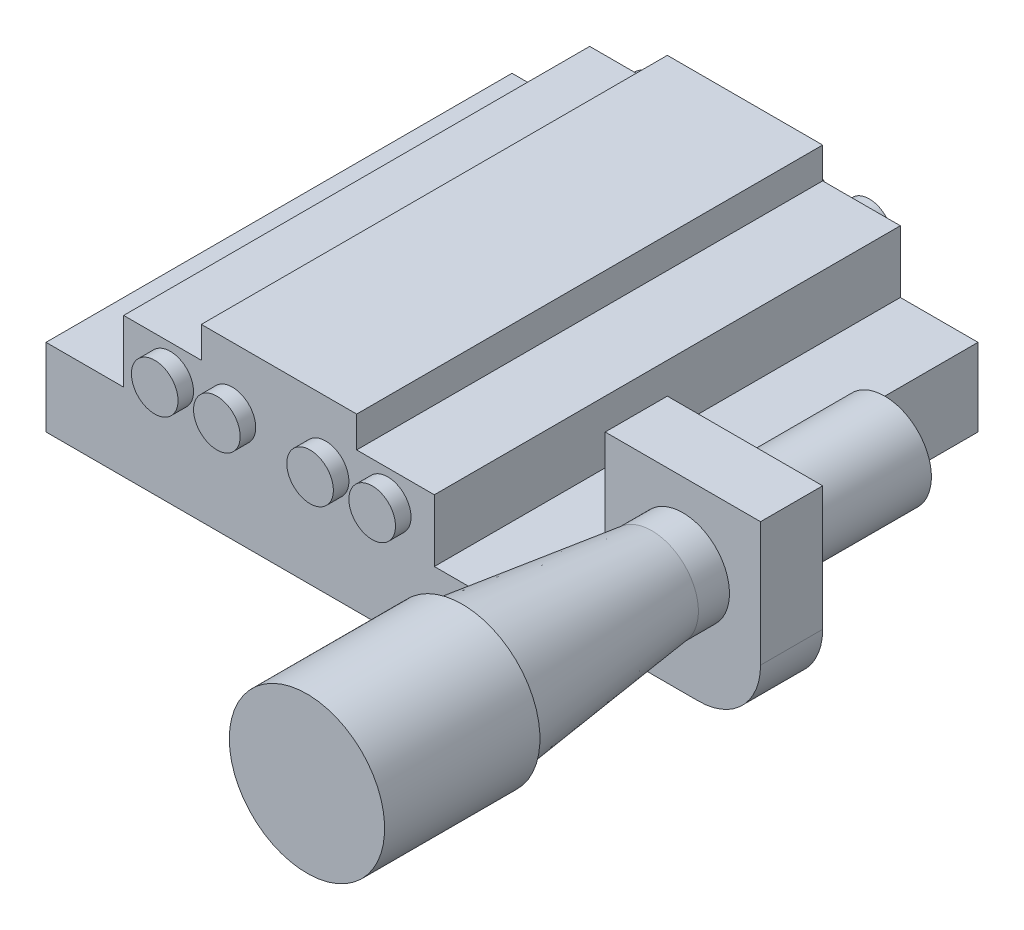
from build123d import *

# Parameters (mm, degrees)
SKETCH_2_W          = 30
SKETCH_2_H          = 30
EXTRUDE_1_DEPTH     = 5
SKETCH_3_R          = 1
CUT_EXTRUDE_1_DEPTH = 3
EXTRUDE_2_DEPTH     = 30
SKETCH_6_W          = 15
SKETCH_6_H          = 2
EXTRUDE_3_DEPTH     = 8
SKETCH_7_W          = 10
SKETCH_7_H          = 4
EXTRUDE_4_DEPTH     = 10
SKETCH_10_W         = 8
SKETCH_10_H         = 2
CUT_EXTRUDE_2_DEPTH = 7
SKETCH_11_W         = 8
SKETCH_11_H         = 2
CUT_EXTRUDE_3_DEPTH = 4
SKETCH_12_W         = 4
SKETCH_12_H         = 2
EXTRUDE_5_DEPTH     = 4
FILLET_1_R          = 4
FILLET_2_R          = 2
SKETCH_13_R         = 1.5
EXTRUDE_6_DEPTH     = 1
EXTRUDE_START       = 1
SKETCH_14_R         = 1.5
EXTRUDE_7_DEPTH     = 1


with BuildPart() as part:
    # Эскиз2 → Бобышка-Вытянуть1 (new body)
    with BuildSketch(Plane(origin=(0, 0, 0), x_dir=(1, 0, 0), z_dir=(0, 1, 0))):
        with Locations((15, 15)):
            Rectangle(SKETCH_2_W, SKETCH_2_H)
    extrude(amount=EXTRUDE_1_DEPTH)

    # Эскиз3 → Вырез-Вытянуть1 (cut)
    with BuildSketch(Plane.XZ):
        with Locations(Location((27, -3, 0), (0, 0, 270))):
            Circle(SKETCH_3_R)
        with Locations(Location((27, -27, 0), (0, 0, 270))):
            Circle(SKETCH_3_R)
        with Locations(Location((3, -27, 0), (0, 0, 270))):
            Circle(SKETCH_3_R)
        with Locations(Location((3, -3, 0), (0, 0, 270))):
            Circle(SKETCH_3_R)
    extrude(amount=-CUT_EXTRUDE_1_DEPTH, mode=Mode.SUBTRACT)

    # Эскиз5 → Бобышка-Вытянуть2 (add)
    with BuildSketch(Plane.XY):
        Polygon((10, 9), (5, 9), (5, 5), (25, 5), (25, 9), (20, 9), (20, 11), (10, 11), align=None)
    extrude(amount=-EXTRUDE_2_DEPTH)

    # Эскиз6 → Бобышка-Вытянуть3 (add)
    with BuildSketch(Plane(origin=(30, 0, 0), x_dir=(0, 0, -1), z_dir=(1, 0, 0))):
        with Locations((7.5, 3)):
            Rectangle(SKETCH_6_W, SKETCH_6_H)
    extrude(amount=EXTRUDE_3_DEPTH)

    # Эскиз7 → Бобышка-Вытянуть4 (add)
    with BuildSketch(Plane(origin=(0, 4, 0), x_dir=(1, 0, 0), z_dir=(0, 1, 0))):
        with Locations((37, 6)):
            Rectangle(SKETCH_7_W, SKETCH_7_H)
    extrude(amount=EXTRUDE_4_DEPTH)

    # Эскиз9 → Повернуть1 (revolve)
    with BuildSketch(Plane.ZY.offset(-37), mode=Mode.PRIVATE) as revolve_1_sk:
        Polygon((20.2, 9), (20.2, 14), (10.2, 14), (10.2, 13.5), (-2, 12), (-17, 12), (-17, 10.5), (-18, 10.5), (-18, 9), align=None)
    revolve(revolve_1_sk.sketch.rotate(Axis((37, 9, -4), (0, 0, 1)), 90), axis=Axis((37, 9, -4), (0, 0, 1)))

    # Эскиз10 → Вырез-Вытянуть2 (cut)
    with BuildSketch(Plane(origin=(0, 0, -15), x_dir=(-1, 0, 0), z_dir=(0, 0, -1))):
        with Locations((-34, 3)):
            Rectangle(SKETCH_10_W, SKETCH_10_H)
    extrude(amount=-CUT_EXTRUDE_2_DEPTH, mode=Mode.SUBTRACT)

    # Эскиз11 → Вырез-Вытянуть3 (cut)
    with BuildSketch(Plane.XY):
        with Locations((34, 3)):
            Rectangle(SKETCH_11_W, SKETCH_11_H)
    extrude(amount=-CUT_EXTRUDE_3_DEPTH, mode=Mode.SUBTRACT)

    # Эскиз12 → Бобышка-Вытянуть5 (add)
    with BuildSketch(Plane(origin=(38, 0, 0), x_dir=(0, 0, -1), z_dir=(1, 0, 0))):
        with Locations((6, 3)):
            Rectangle(SKETCH_12_W, SKETCH_12_H)
    extrude(amount=EXTRUDE_5_DEPTH)

    # Скругление1
    fillet_1_edges = [part.edges().sort_by_distance(p)[0] for p in [
        (42, 2, -6),
    ]]
    fillet(fillet_1_edges, radius=FILLET_1_R)

    # Скругление2
    fillet_2_edges = [part.edges().sort_by_distance(p)[0] for p in [
        (32, 4, -6),
    ]]
    fillet(fillet_2_edges, radius=FILLET_2_R - 0.0001)  # a hair under: the kernel refuses the full size

    # Эскиз13 → Бобышка-Вытянуть6 (add)
    with BuildSketch(Plane.XY):
        with Locations(Location((8, 7, 0), (0, 0, 180))):
            Circle(SKETCH_13_R)
        with Locations(Location((12, 7, 0), (0, 0, 180))):
            Circle(SKETCH_13_R)
        with Locations(Location((22, 7, 0), (0, 0, 180))):
            Circle(SKETCH_13_R)
        with Locations(Location((18, 7, 0), (0, 0, 180))):
            Circle(SKETCH_13_R)
    extrude(amount=EXTRUDE_6_DEPTH)

    # Эскиз14 → Бобышка-Вытянуть7 (add)
    with BuildSketch(Plane(origin=(0, 0, -30), x_dir=(-1, 0, 0), z_dir=(0, 0, -1)).offset(EXTRUDE_START)):
        with Locations((-8, 7)):
            Circle(SKETCH_14_R)
        with Locations((-12, 7)):
            Circle(SKETCH_14_R)
        with Locations((-18, 7)):
            Circle(SKETCH_14_R)
        with Locations((-22, 7)):
            Circle(SKETCH_14_R)
    extrude(amount=-EXTRUDE_7_DEPTH)


solid = part.part
